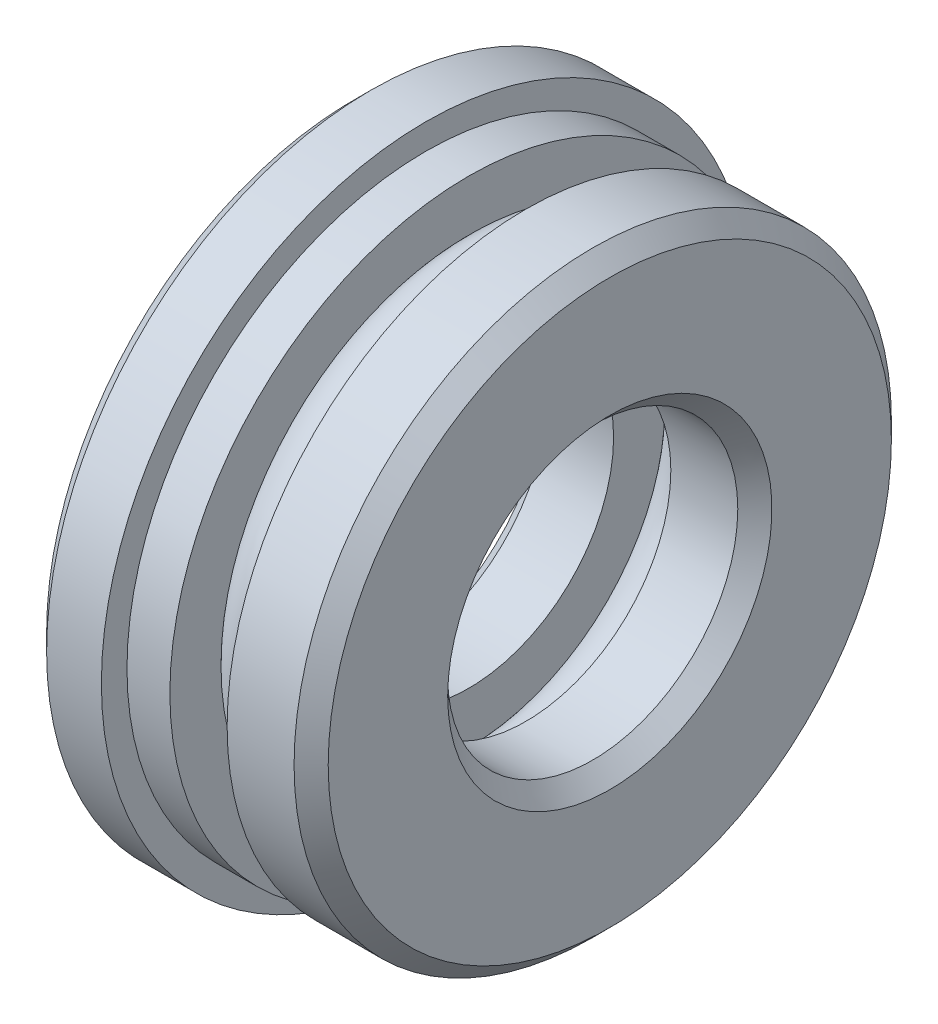
from build123d import *

# Parameters (mm, degrees)
REVOLVE_3_OUTLINE_R = 2.25


# Read off the part's stored shape, not the designer's step: Повернуть3
with BuildPart() as part:
    # Эскиз3 → Повернуть1 (revolve)
    with BuildSketch(Plane.XY, mode=Mode.PRIVATE) as revolve_1_sk:
        with BuildLine():
            Line((4.209143351, 17.486695989), (4.209143351, 18.986695989))
            Line((4.209143351, 18.986695989), (1, 18.986695989))
            Line((1, 18.986695989), (0, 17.986695989))
            Line((0, 17.986695989), (0, 13.077150527))
            Line((0, 13.077150527), (1.8, 13.077150527))
            ThreePointArc((1.8, 13.077150527), (2.917887724, 15.329282802), (4.209143351, 17.486695989))
        make_face()
    revolve(revolve_1_sk.sketch.rotate(Axis((1.8, -0.013304011, 0), (1, 0, 0)), 90), axis=Axis((1.8, -0.013304011, 0), (1, 0, 0)))


with BuildPart() as body_2:
    # Эскиз5 → Повернуть2 (revolve)
    with BuildSketch(Plane.XY, mode=Mode.PRIVATE) as revolve_2_sk:
        with BuildLine():
            Line((4.209143351, 17.486695989), (6.722949017, 17.486695989))
            Line((6.722949017, 17.486695989), (6.722949017, 14.486695989))
            ThreePointArc((6.722949017, 14.486695989), (6.15, 12.986695989), (6.722949017, 11.486695989))
            Line((6.722949017, 11.486695989), (6.722949017, 8.486695989))
            Line((6.722949017, 8.486695989), (2.8, 8.486695989))
            Line((2.8, 8.486695989), (1.8, 9.486695989))
            Line((1.8, 9.486695989), (1.8, 13.077150527))
            ThreePointArc((1.8, 13.077150527), (2.917887724, 15.329282802), (4.209143351, 17.486695989))
        make_face()
    revolve(revolve_2_sk.sketch.rotate(Axis((1.8, -0.013304011, 0), (1, 0, 0)), 90), axis=Axis((1.8, -0.013304011, 0), (1, 0, 0)))


with BuildPart() as body_3:
    # Повернуть3 outline → Повернуть3 (revolve)
    with BuildSketch(Plane(origin=(0, -0.013304011, 0), x_dir=(0, 1, 0), z_dir=(0, 0, -1))):
        with Locations((13, 8.4)):
            Circle(REVOLVE_3_OUTLINE_R)
    revolve(axis=Axis((0, -0.013304011, 0), (1, 0, 0)))


with BuildPart() as body_4:
    # Эскиз7 → Повернуть4 (revolve)
    with BuildSketch(Plane.XY, mode=Mode.PRIVATE) as revolve_4_sk:
        with BuildLine():
            Line((10.077050983, 11.486695989), (10.077050983, 8.486695989))
            Line((10.077050983, 8.486695989), (14, 8.486695989))
            Line((14, 8.486695989), (15, 9.486695989))
            Line((15, 9.486695989), (15, 16.486695989))
            Line((15, 16.486695989), (14, 17.486695989))
            Line((14, 17.486695989), (10.077050983, 17.486695989))
            Line((10.077050983, 17.486695989), (10.077050983, 14.486695989))
            ThreePointArc((10.077050983, 14.486695989), (10.65, 12.986695989), (10.077050983, 11.486695989))
        make_face()
    revolve(revolve_4_sk.sketch.rotate(Axis((15, -0.013304011, 0), (1, 0, 0)), 90), axis=Axis((15, -0.013304011, 0), (1, 0, 0)))


solid = Compound([part.part, body_2.part, body_3.part, body_4.part])
